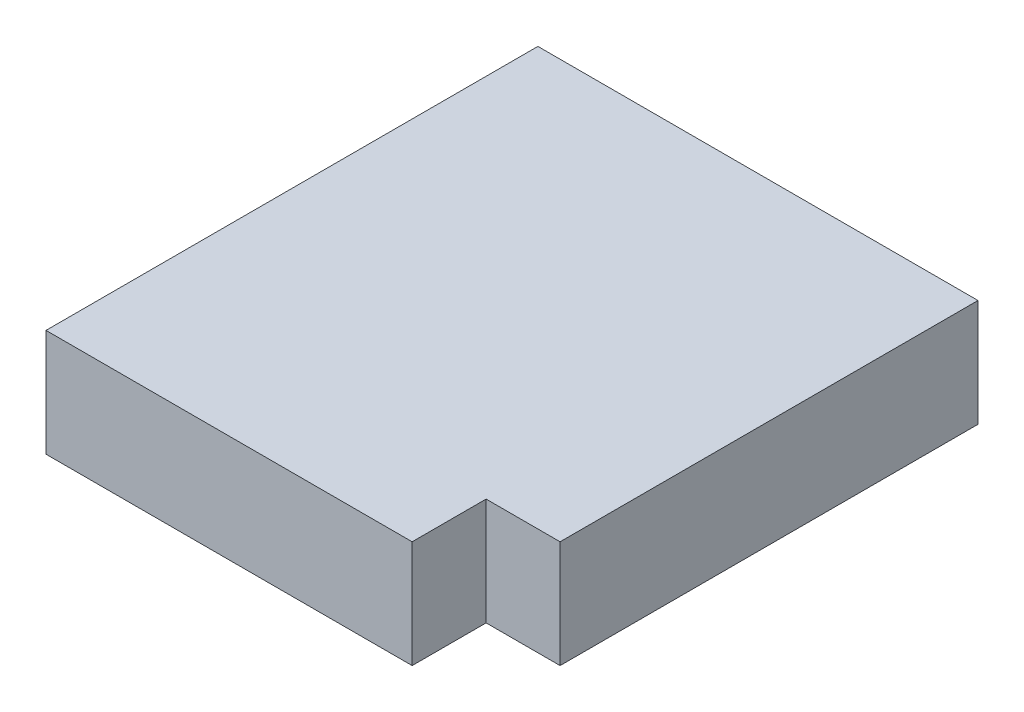
from build123d import *

# Parameters (mm, degrees)
SKETCH1_W           = 29.75
SKETCH1_H           = 33.25
BOSS_EXTRUDE1_DEPTH = 7.25
SKETCH2_W           = 5
SKETCH2_H           = 5
CUT_EXTRUDE1_DEPTH  = 10


with BuildPart() as part:
    # Sketch1 → Boss-Extrude1 (new body)
    with BuildSketch(Plane(origin=(0, 0, 0), x_dir=(1, 0, 0), z_dir=(0, 1, 0))):
        with Locations((14.875, 16.625)):
            Rectangle(SKETCH1_W, SKETCH1_H)
    extrude(amount=BOSS_EXTRUDE1_DEPTH)

    # Sketch2 → Cut-Extrude1 (cut)
    with BuildSketch(Plane(origin=(0, 7.25, 0), x_dir=(1, 0, 0), z_dir=(0, 1, 0))):
        with Locations((27.25, 2.5)):
            Rectangle(SKETCH2_W, SKETCH2_H)
    extrude(amount=-CUT_EXTRUDE1_DEPTH, mode=Mode.SUBTRACT)


solid = part.part
